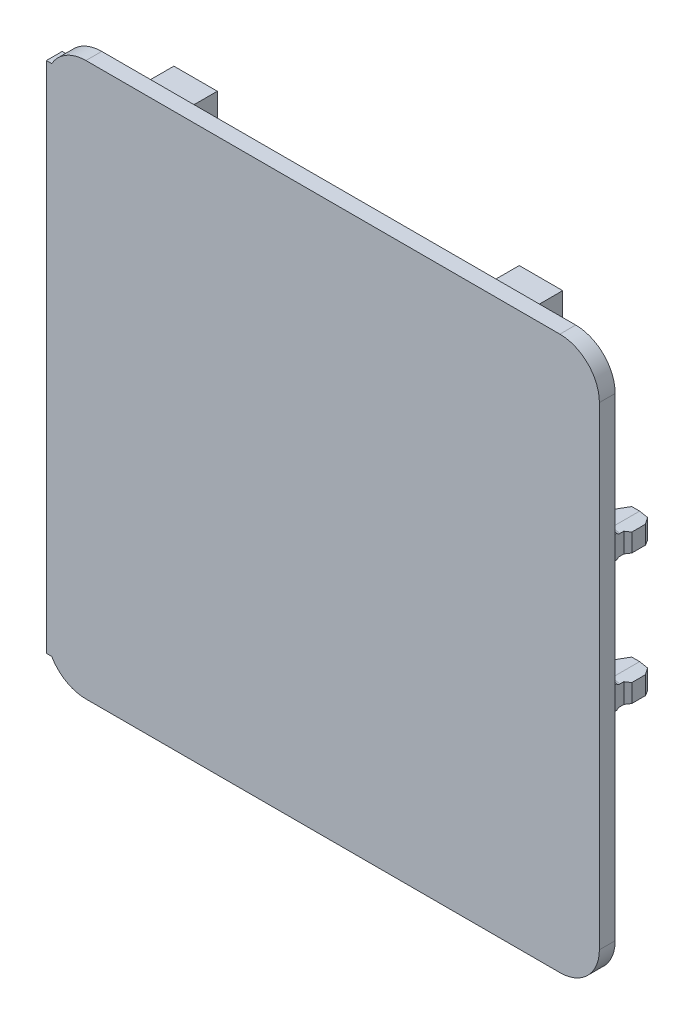
from build123d import *

# Parameters (mm, degrees)
EXTRUDE_1_DEPTH     = 2
EXTRUDE_2_DEPTH     = 5
SKETCH_3_W          = 2
SKETCH_3_H          = 1.9
SKETCH_3_H_2        = 2.9
EXTRUDE_3_DEPTH     = 3.2
SKETCH_4_W          = 3.15
SKETCH_4_H          = 1.9
SKETCH_4_H_2        = 2.9
SKETCH_4_W_2        = 3
EXTRUDE_4_DEPTH     = 3
SKETCH_6_W          = 3.15
SKETCH_6_H          = 2.9
SKETCH_6_H_2        = 1.9
EXTRUDE_5_DEPTH     = 0.7
EXTRUDE_6_DEPTH     = 1.9
EXTRUDE_7_DEPTH     = 2.9
EXTRUDE_8_DEPTH     = 2.9
EXTRUDE_9_DEPTH     = 2.9
FILLET_1_R          = 2
CUT_EXTRUDE_1_REACH = 61.364
SKETCH_12_W         = 4.7
SKETCH_12_H         = 9
EXTRUDE_10_DEPTH    = 0.8
CHAMFER_1_SIZE      = 1
CUT_EXTRUDE_2_DEPTH = 20
CUT_EXTRUDE_3_DEPTH = 4
FILLET_2_R          = 0.5


with BuildPart() as part:
    # 草图1 → 凸台-拉伸1 (new body)
    with BuildSketch(Plane.XY):
        with BuildLine():
            Line((-30, -35), (30, -35))
            ThreePointArc((30, -35), (33.535533906, -33.535533906), (35, -30))
            Line((35, -30), (35, 30))
            ThreePointArc((35, 30), (33.535533906, 33.535533906), (30, 35))
            Line((30, 35), (-30, 35))
            ThreePointArc((-30, 35), (-32.5, 34.330127019), (-34.330127019, 32.5))
            Line((-34.330127019, 32.5), (-35, 32.5))
            Line((-35, 32.5), (-35, 30))
            Line((-35, 30), (-35, -30))
            Line((-35, -30), (-35, -32.5))
            Line((-35, -32.5), (-34.330127019, -32.5))
            ThreePointArc((-34.330127019, -32.5), (-32.5, -34.330127019), (-30, -35))
        make_face()
    extrude(amount=EXTRUDE_1_DEPTH)

    # 草图2 → 凸台-拉伸2 (add)
    with BuildSketch(Plane(origin=(0, 0, 0), x_dir=(-1, 0, 0), z_dir=(0, 0, -1))):
        with BuildLine():
            Line((25.867224141, -32.95), (25.867224141, -29.95))
            ThreePointArc((25.867224141, -29.95), (23.117224141, -27.2), (20.367224141, -29.95))
            Line((20.367224141, -29.95), (20.367224141, -32.95))
            Line((20.367224141, -32.95), (25.867224141, -32.95))
        make_face()
        with BuildLine():
            Line((20.367224141, 32.95), (20.367224141, 29.95))
            ThreePointArc((20.367224141, 29.95), (23.117224141, 27.2), (25.867224141, 29.95))
            Line((25.867224141, 29.95), (25.867224141, 32.95))
            Line((25.867224141, 32.95), (20.367224141, 32.95))
        make_face()
        with BuildLine():
            Line((-23.357009719, -29.95), (-23.357009719, -32.95))
            Line((-23.357009719, -32.95), (-17.857009719, -32.95))
            Line((-17.857009719, -32.95), (-17.857009719, -29.95))
            ThreePointArc((-17.857009719, -29.95), (-20.607009719, -27.2), (-23.357009719, -29.95))
        make_face()
        with BuildLine():
            Line((-23.357009719, 32.95), (-17.857009719, 32.95))
            Line((-17.857009719, 32.95), (-17.857009719, 29.95))
            ThreePointArc((-17.857009719, 29.95), (-20.607009719, 27.2), (-23.357009719, 29.95))
            Line((-23.357009719, 29.95), (-23.357009719, 32.95))
        make_face()
    extrude(amount=EXTRUDE_2_DEPTH)

    # 草图3 → 凸台-拉伸3 (add)
    with BuildSketch(Plane(origin=(0, 0, 0), x_dir=(-1, 0, 0), z_dir=(0, 0, -1))):
        with Locations((31.9, -29)):
            Rectangle(SKETCH_3_W, SKETCH_3_H)
        with Locations((31.9, 21.5)):
            Rectangle(SKETCH_3_W, SKETCH_3_H_2)
        with Locations((-31.9, -5.5)):
            Rectangle(SKETCH_3_W, SKETCH_3_H_2)
        with Locations((-31.9, 11)):
            Rectangle(SKETCH_3_W, SKETCH_3_H_2)
    extrude(amount=EXTRUDE_3_DEPTH)

    # 草图4 → 凸台-拉伸4 (add)
    with BuildSketch(Plane(origin=(0, 0, -3.2), x_dir=(-1, 0, 0), z_dir=(0, 0, -1))):
        with Locations((32.475, -29)):
            Rectangle(SKETCH_4_W, SKETCH_4_H)
        with Locations((32.475, 21.5)):
            Rectangle(SKETCH_4_W, SKETCH_4_H_2)
        with Locations((-32.4, -5.5)):
            Rectangle(SKETCH_4_W_2, SKETCH_4_H_2)
        with Locations((-32.4, 11)):
            Rectangle(SKETCH_4_W_2, SKETCH_4_H_2)
    extrude(amount=EXTRUDE_4_DEPTH)

    # 草图6 → 凸台-拉伸5 (add)
    with BuildSketch(Plane(origin=(0, 0, -6.2), x_dir=(-1, 0, 0), z_dir=(0, 0, -1))):
        with Locations((32.475, 21.5)):
            Rectangle(SKETCH_6_W, SKETCH_6_H)
        with Locations((32.475, -29)):
            Rectangle(SKETCH_6_W, SKETCH_6_H_2)
    extrude(amount=EXTRUDE_5_DEPTH)

    # 草图7 → 凸台-拉伸6 (add)
    with BuildSketch(Plane.XZ.offset(29.95)):
        Polygon((-30.9, -6.9), (-26.916283143, 0), (-30.9, 0), align=None)
    extrude(amount=-EXTRUDE_6_DEPTH)

    # 草图8 → 凸台-拉伸7 (add)
    with BuildSketch(Plane(origin=(0, 22.95, 0), x_dir=(1, 0, 0), z_dir=(0, 1, 0))):
        Polygon((-30.9, 6.9), (-26.916283143, 0), (-30.9, 0), align=None)
    extrude(amount=-EXTRUDE_7_DEPTH)

    # 草图9 → 凸台-拉伸8 (add)
    with BuildSketch(Plane(origin=(0, 12.45, 0), x_dir=(1, 0, 0), z_dir=(0, 1, 0))):
        Polygon((30.9, 6.2), (27.320428331, 0), (30.9, 0), align=None)
    extrude(amount=-EXTRUDE_8_DEPTH)

    # 草图10 → 凸台-拉伸9 (add)
    with BuildSketch(Plane.XZ.offset(6.95)):
        Polygon((30.9, -6.2), (27.320428331, 0), (30.9, 0), align=None)
    extrude(amount=-EXTRUDE_9_DEPTH)

    # 圆角1
    fillet_1_edges = [part.edges().sort_by_distance(p)[0] for p in [
        (-29.908141571, 22.95, 0),
        (-29.908141571, 20.05, 0),
        (30.110214166, -6.95, 0),
        (30.110214166, 12.45, 0),
        (-29.908141571, -28.05, 0),
        (-29.908141571, -29.95, 0),
    ]]
    fillet(fillet_1_edges, radius=FILLET_1_R)

    # 切除-拉伸1: up to this face of the body (flat: up to its plane)
    cut_extrude_1_end = Plane(part.part.faces().sort_by_distance((31.614518318, -6.95, -3.993006547))[0])
    # 草图11 → 切除-拉伸1 (cut, up to the picked face)
    with BuildSketch(Plane(origin=(0, 12.45, 0), x_dir=(1, 0, 0), z_dir=(0, 1, 0)), mode=Mode.PRIVATE) as cut_extrude_1_sk1:
        Polygon((33.4, 3.2), (33.9, 3.7), (33.9, 3.2), align=None)
    cut_extrude_1_tool1 = split(extrude(cut_extrude_1_sk1.sketch, amount=-CUT_EXTRUDE_1_REACH, mode=Mode.PRIVATE), bisect_by=cut_extrude_1_end, keep=Keep.BOTH, mode=Mode.PRIVATE)
    add(cut_extrude_1_tool1.solids().sort_by(Axis((33.733333, 12.45, -3.366667), (0, -1, 0)))[0], mode=Mode.SUBTRACT)

    # 草图12 → 凸台-拉伸10 (add)
    with BuildSketch(Plane(origin=(0, 0, 0), x_dir=(-1, 0, 0), z_dir=(0, 0, -1))):
        with Locations((-29.65, 2.733632703)):
            Rectangle(SKETCH_12_W, SKETCH_12_H)
    extrude(amount=EXTRUDE_10_DEPTH)

    # 倒角1
    chamfer_1_edges = [part.edges().sort_by_distance(p)[0] for p in [
        (33.9, -5.5, -6.2),
        (33.9, 11, -6.2),
    ]]
    chamfer(chamfer_1_edges, length=CHAMFER_1_SIZE)

    # 草图13 → 切除-拉伸2 (cut)
    with BuildSketch(Plane.XZ.offset(6.95)):
        Polygon((32.9, -3.2), (33.4, -3.7), (33.4, -5.430067518), (32.9, -6.2), (33.9, -5.2), (33.9, -3.7), (33.4, -3.2), align=None)
    extrude(amount=-CUT_EXTRUDE_2_DEPTH, mode=Mode.SUBTRACT)

    # 草图14 → 切除-拉伸3 (cut)
    with BuildSketch(Plane(origin=(0, 0, -6.2), x_dir=(-1, 0, 0), z_dir=(0, 0, -1))):
        Polygon((-33.4, 12.15), (-31.9, 12.45), (-33.4, 12.45), align=None)
        Polygon((-33.4, 9.55), (-33.4, 9.85), (-31.9, 9.55), align=None)
        Polygon((-33.4, -4.05), (-33.4, -4.35), (-31.9, -4.05), align=None)
        Polygon((-33.4, -6.95), (-31.9, -6.95), (-33.4, -6.65), align=None)
    extrude(amount=-CUT_EXTRUDE_3_DEPTH, mode=Mode.SUBTRACT)

    # 圆角2
    # the kernel refuses this fillet: 0.5 mm, written as the material it adds along each edge
    with BuildSketch(Plane(origin=(34.125725845, 9.995145169, -2.2), x_dir=(0, 0, -1), z_dir=(-0.9805806756909201, -0.1961161351381845, 0))) as fillet_2_piece_1_section:
        with BuildLine():
            CenterArc((FILLET_2_R, FILLET_2_R), FILLET_2_R, 180, 90)
            Line((0, FILLET_2_R), (0, 0))
            Line((0, 0), (FILLET_2_R, 0))
        make_face()
    fillet_2_piece_1 = extrude(amount=3.519803903, mode=Mode.PRIVATE)
    fillet_2_piece_1 = split(fillet_2_piece_1, bisect_by=Plane(origin=(32.9, 9.624038043, -2.351425579), z_dir=(-1, 0, 0)), keep=Keep.TOP, mode=Mode.PRIVATE)
    fillet_2_piece_1 = split(fillet_2_piece_1, bisect_by=Plane(origin=(32.529809776, 9.55, -2.351425579), z_dir=(0, 1, 0)), keep=Keep.TOP, mode=Mode.PRIVATE)
    add(fillet_2_piece_1)
    with BuildSketch(Plane(origin=(34.125725845, 12.004854831, -2.2), x_dir=(0.1961161351381845, 0.9805806756909201, 0), z_dir=(-0.9805806756909201, 0.1961161351381845, 0))) as fillet_2_piece_2_section:
        with BuildLine():
            CenterArc((FILLET_2_R, FILLET_2_R), FILLET_2_R, 180, 90)
            Line((0, FILLET_2_R), (0, 0))
            Line((0, 0), (FILLET_2_R, 0))
        make_face()
    fillet_2_piece_2 = extrude(amount=3.519803903, mode=Mode.PRIVATE)
    fillet_2_piece_2 = split(fillet_2_piece_2, bisect_by=Plane(origin=(32.9, 12.375961957, -2.351425579), z_dir=(-1, 0, 0)), keep=Keep.TOP, mode=Mode.PRIVATE)
    fillet_2_piece_2 = split(fillet_2_piece_2, bisect_by=Plane(origin=(32.529809778, 12.45, -2.351425579), z_dir=(0, -1, 0)), keep=Keep.TOP, mode=Mode.PRIVATE)
    add(fillet_2_piece_2)
    with BuildSketch(Plane(origin=(34.125725845, -4.495145169, -2.2), x_dir=(0, 0, -1), z_dir=(-0.9805806756909202, 0.1961161351381839, 0))) as fillet_2_piece_3_section:
        with BuildLine():
            CenterArc((FILLET_2_R, -FILLET_2_R), FILLET_2_R, 90, 90)
            Line((0, -FILLET_2_R), (0, 0))
            Line((0, 0), (FILLET_2_R, 0))
        make_face()
    fillet_2_piece_3 = extrude(amount=3.519803903, mode=Mode.PRIVATE)
    fillet_2_piece_3 = split(fillet_2_piece_3, bisect_by=Plane(origin=(32.529809776, -4.05, -2.351425579), z_dir=(0, -1, 0)), keep=Keep.TOP, mode=Mode.PRIVATE)
    fillet_2_piece_3 = split(fillet_2_piece_3, bisect_by=Plane(origin=(32.9, -4.124038043, -2.351425579), z_dir=(-1, 0, 0)), keep=Keep.TOP, mode=Mode.PRIVATE)
    add(fillet_2_piece_3)
    with BuildSketch(Plane(origin=(30.674274155, -7.195145169, -2.2), x_dir=(0, 0, -1), z_dir=(0.9805806756909202, 0.1961161351381839, 0))) as fillet_2_piece_4_section:
        with BuildLine():
            CenterArc((FILLET_2_R, -FILLET_2_R), FILLET_2_R, 90, 90)
            Line((0, -FILLET_2_R), (0, 0))
            Line((0, 0), (FILLET_2_R, 0))
        make_face()
    fillet_2_piece_4 = extrude(amount=3.519803903, mode=Mode.PRIVATE)
    fillet_2_piece_4 = split(fillet_2_piece_4, bisect_by=Plane(origin=(32.9, -6.875961957, -2.351425579), z_dir=(-1, 0, 0)), keep=Keep.TOP, mode=Mode.PRIVATE)
    fillet_2_piece_4 = split(fillet_2_piece_4, bisect_by=Plane(origin=(32.529809776, -6.95, -2.351425579), z_dir=(0, 1, 0)), keep=Keep.TOP, mode=Mode.PRIVATE)
    add(fillet_2_piece_4)


solid = part.part
